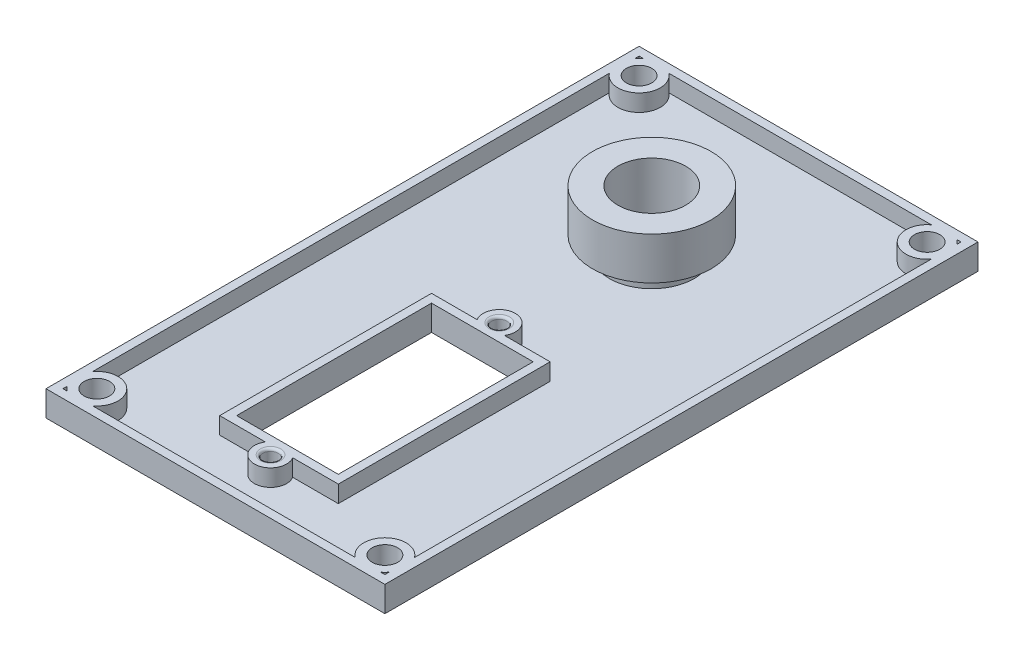
from build123d import *
from build123d.topology import SkipClean

# Parameters (mm, degrees)
SKETCH_1_W            = 40
SKETCH_1_H            = 70
SKETCH_1_W_2          = 12
SKETCH_1_H_2          = 23
EXTRUDE_1_DEPTH       = 3
SKETCH_2_R            = 0.9
CUT_EXTRUDE_1_DEPTH   = 3
SKETCH_3_R            = 1.5
CUT_EXTRUDE_2_DEPTH   = 41.422765863
CHAMFER_1_SIZE        = 0.5
FILLET_1_R            = 0.3
SKETCH_4_R            = 4
CUT_EXTRUDE_3_DEPTH   = 41.422765863
SKETCH_6_R            = 7
SKETCH_6_R_2          = 4
EXTRUDE_1_2_DEPTH     = 5
SHELL_START           = 1
SHELL_1_OUTLINE_R     = 5
SHELL_1_DEPTH         = 2
SHELL_START_2         = 3
SHELL_1_2_OUTLINE_R   = 6
SHELL_1_2_OUTLINE_R_2 = 5
SHELL_1_2_DEPTH       = 4


# Read off the part's stored shape, not the designer's step: 抽壳1
with BuildPart() as part:
    # 草图1 → Extrude 1 (new body)
    with BuildSketch(Plane(origin=(0, 0, 0), x_dir=(1, 0, 0), z_dir=(0, 1, 0))):
        Rectangle(SKETCH_1_W, SKETCH_1_H)
        with Locations((0, -15)):
            Rectangle(SKETCH_1_W_2, SKETCH_1_H_2, mode=Mode.SUBTRACT)
    extrude(amount=EXTRUDE_1_DEPTH)

    # 草图2 → 切除-拉伸1 (cut)
    with BuildSketch(Plane(origin=(0, 3, 0), x_dir=(1, 0, 0), z_dir=(0, 1, 0))):
        with Locations(Location((0, -28.5, 0), (0, 0, 270))):
            Circle(SKETCH_2_R)
        with Locations(Location((0, -1.5, 0), (0, 0, 270))):
            Circle(SKETCH_2_R)
    extrude(amount=-CUT_EXTRUDE_1_DEPTH, mode=Mode.SUBTRACT)

    # 草图3 → 切除-拉伸2 (cut, through all)
    with BuildSketch(Plane(origin=(0, 3, 0), x_dir=(1, 0, 0), z_dir=(0, 1, 0))):
        with Locations(Location((-17, 32, 0), (0, 0, 270))):
            Circle(SKETCH_3_R)
        with Locations(Location((17, 32, 0), (0, 0, 270))):
            Circle(SKETCH_3_R)
        with Locations(Location((-17, -32, 0), (0, 0, 270))):
            Circle(SKETCH_3_R)
        with Locations(Location((17, -32, 0), (0, 0, 270))):
            Circle(SKETCH_3_R)
    extrude(amount=-CUT_EXTRUDE_2_DEPTH, mode=Mode.SUBTRACT)

    # 倒角1
    chamfer_1_edges = [part.edges().sort_by_distance(p)[0] for p in [
        (17, 0, -33.5),
        (-17, 0, 30.5),
        (17, 0, 30.5),
        (-17, 0, -33.5),
    ]]
    chamfer(chamfer_1_edges, length=CHAMFER_1_SIZE)

    # 圆角1
    fillet_1_edges = [part.edges().sort_by_distance(p)[0] for p in [
        (0, 3, 27.6),
        (0, 3, 0.6),
    ]]
    fillet(fillet_1_edges, radius=FILLET_1_R)

    # 草图4 → 切除-拉伸3 (cut, through all)
    with BuildSketch(Plane.XZ):
        with Locations(Location((0, -16.5, 0), (0, 0, 270))):
            Circle(SKETCH_4_R)
    extrude(amount=-CUT_EXTRUDE_3_DEPTH, mode=Mode.SUBTRACT)

    # 草图6 → Extrude 1 2 (add)
    with SkipClean():  # the faces are left unmerged after this step: merging them gives an invalid solid
        with BuildSketch(Plane(origin=(0, 3, 0), x_dir=(1, 0, 0), z_dir=(0, 1, 0))):
            with Locations((0, 16.5)):
                Circle(SKETCH_6_R)
            with Locations((0, 16.5)):
                Circle(SKETCH_6_R_2, mode=Mode.SUBTRACT)
        extrude(amount=EXTRUDE_1_2_DEPTH)

    # 抽壳1 outline → 抽壳1 (cut)
    # profile 1 of 5: a face of its own
    with SkipClean():  # the faces are left unmerged after this step: merging them gives an invalid solid
        with BuildSketch(Plane(origin=(0, 0, 0), x_dir=(1, 0, 0), z_dir=(0, 1, 0)).offset(SHELL_START)):
            with BuildLine():
                ThreePointArc((-18.5, -34), (-18.767766953, -33.767766953), (-19, -33.5))
                Line((-19, -33.5), (-19, -34))
                Line((-19, -34), (-18.5, -34))
            make_face()
        # profile 2 of 5: a face of its own
        with BuildSketch(Plane(origin=(0, 0, 0), x_dir=(1, 0, 0), z_dir=(0, 1, 0)).offset(SHELL_START)):
            with BuildLine():
                ThreePointArc((-19, -30.5), (-15.232233047, -30.232233047), (-15.5, -34))
                Line((-15.5, -34), (15.5, -34))
                ThreePointArc((15.5, -34), (15.232233047, -30.232233047), (19, -30.5))
                Line((19, -30.5), (19, 30.5))
                ThreePointArc((19, 30.5), (15.232233047, 30.232233047), (15.5, 34))
                Line((15.5, 34), (-15.5, 34))
                ThreePointArc((-15.5, 34), (-15.232233047, 30.232233047), (-19, 30.5))
                Line((-19, 30.5), (-19, -30.5))
            make_face()
            with BuildLine():
                ThreePointArc((1.615549442, -27.5), (0, -30.4), (-1.615549442, -27.5))
                Line((-1.615549442, -27.5), (-7, -27.5))
                Line((-7, -27.5), (-7, -2.5))
                Line((-7, -2.5), (-1.615549442, -2.5))
                ThreePointArc((-1.615549442, -2.5), (0, 0.4), (1.615549442, -2.5))
                Line((1.615549442, -2.5), (7, -2.5))
                Line((7, -2.5), (7, -27.5))
                Line((7, -27.5), (1.615549442, -27.5))
            make_face(mode=Mode.SUBTRACT)
            with Locations((0, 16.5)):
                Circle(SHELL_1_OUTLINE_R, mode=Mode.SUBTRACT)
        # profile 3 of 5: a face of its own
        with BuildSketch(Plane(origin=(0, 0, 0), x_dir=(1, 0, 0), z_dir=(0, 1, 0)).offset(SHELL_START)):
            with BuildLine():
                Line((-19, 34), (-19, 33.5))
                ThreePointArc((-19, 33.5), (-18.767766953, 33.767766953), (-18.5, 34))
                Line((-18.5, 34), (-19, 34))
            make_face()
        # profile 4 of 5: a face of its own
        with BuildSketch(Plane(origin=(0, 0, 0), x_dir=(1, 0, 0), z_dir=(0, 1, 0)).offset(SHELL_START)):
            with BuildLine():
                Line((18.5, -34), (19, -34))
                Line((19, -34), (19, -33.5))
                ThreePointArc((19, -33.5), (18.767766953, -33.767766953), (18.5, -34))
            make_face()
        # profile 5 of 5: a face of its own
        with BuildSketch(Plane(origin=(0, 0, 0), x_dir=(1, 0, 0), z_dir=(0, 1, 0)).offset(SHELL_START)):
            with BuildLine():
                Line((19, 34), (18.5, 34))
                ThreePointArc((18.5, 34), (18.767766953, 33.767766953), (19, 33.5))
                Line((19, 33.5), (19, 34))
            make_face()
        extrude(amount=SHELL_1_DEPTH, mode=Mode.SUBTRACT)

    # Shell 1 2 outline → Shell 1 2 (cut)
    with SkipClean():  # the faces are left unmerged after this step: merging them gives an invalid solid
        with BuildSketch(Plane(origin=(0, 0, 0), x_dir=(1, 0, 0), z_dir=(0, 1, 0)).offset(SHELL_START_2)):
            with Locations((0, 16.5)):
                Circle(SHELL_1_2_OUTLINE_R)
            with Locations((0, 16.5)):
                Circle(SHELL_1_2_OUTLINE_R_2, mode=Mode.SUBTRACT)
        extrude(amount=SHELL_1_2_DEPTH, mode=Mode.SUBTRACT)


solid = part.part
